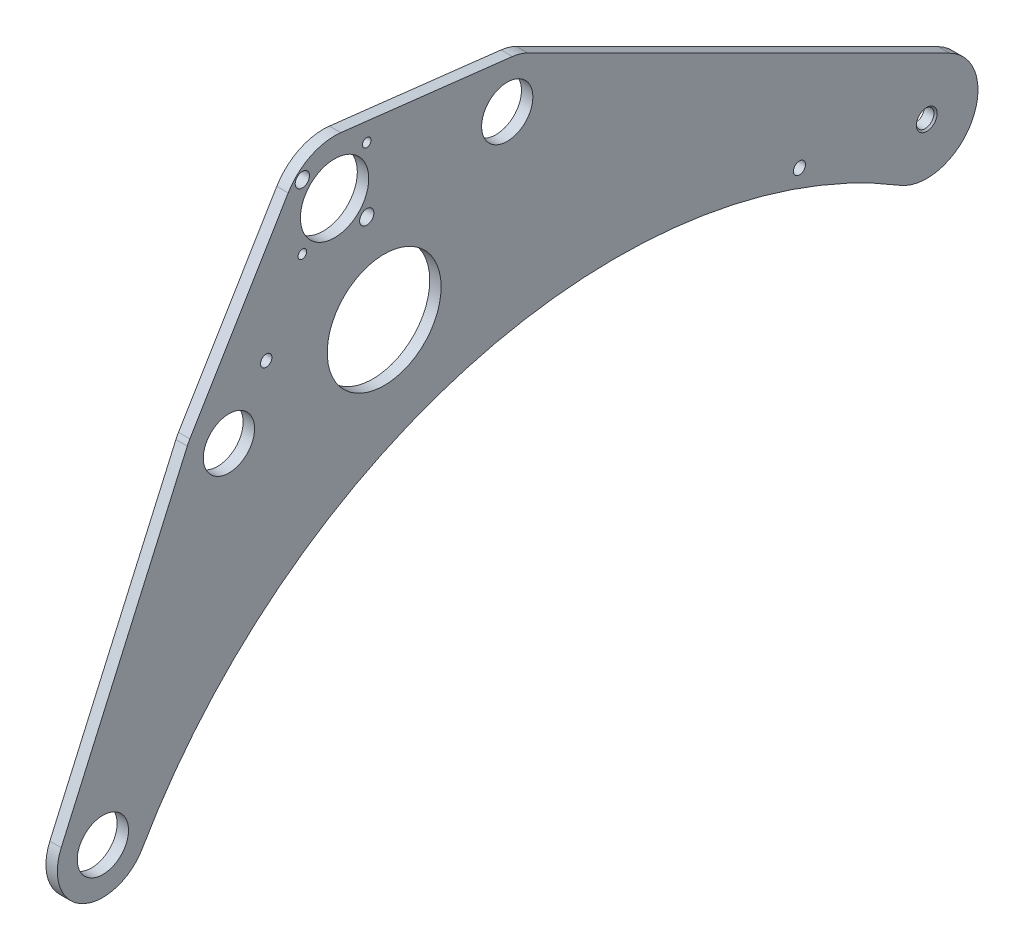
from build123d import *

# Parameters (mm, degrees)
SKETCH2_R                         = 3.3782
BOSS_EXTRUDE1_DEPTH               = 6.35
CUT_EXTRUDE1_REACH                = 511.657
SKETCH3_R                         = 14.2875
SKETCH3_R_2                       = 19.05
SKETCH3_R_3                       = 2.413
SKETCH3_R_4                       = 3.96875
SKETCH3_R_5                       = 3.175
F_3_8_CLEARANCE_HOLE2_D           = 9.8044
F_3_8_CLEARANCE_HOLE2_CSINK_D     = 11.58748
F_3_8_CLEARANCE_HOLE2_CSINK_ANGLE = 90
SKETCH11_R                        = 31.75
CUT_EXTRUDE2_DEPTH                = 510.656927172


with BuildPart() as part:
    # Sketch2 → Boss-Extrude1 (new body)
    with BuildSketch(Plane(origin=(0, 0, 0), x_dir=(0, 0, -1), z_dir=(1, 0, 0))):
        with BuildLine():
            Line((-482.60379809, -110.367631362), (-412.322756293, 48.382368638))
            ThreePointArc((-412.322756293, 48.382368638), (-411.642992745, 49.797905267), (-410.877057917, 51.168732123))
            Line((-410.877057917, 51.168732123), (-356.063745658, 142.519119396))
            ThreePointArc((-356.063745658, 142.519119396), (-343.524529027, 154.059810281), (-326.731846348, 156.96244844))
            Line((-326.731846348, 156.96244844), (-231.000424083, 145.881535528))
            ThreePointArc((-231.000424083, 145.881535528), (-226.66558004, 144.991718321), (-222.550960178, 143.363052937))
            Line((-222.550960178, 143.363052937), (12.791266142, 25.552184554))
            ThreePointArc((12.791266142, 25.552184554), (25.010542, -13.820398469), (-14.82663888, -24.427472332))
            ThreePointArc((-14.82663888, -24.427472332), (-57.930383226, -2.733370147), (-103.917723134, 11.886185744))
            ThreePointArc((-103.917723134, 11.886185744), (-294.655865568, -5.528049493), (-437.347284158, -133.291321323))
            ThreePointArc((-437.347284158, -133.291321323), (-470.855508227, -143.308975656), (-482.60379809, -110.367631362))
        make_face()
        with Locations((-71.00414761, 12.059445777)):
            Circle(SKETCH2_R, mode=Mode.SUBTRACT)
    extrude(amount=BOSS_EXTRUDE1_DEPTH)

    # Sketch3 → Cut-Extrude1 (cut, up to next)
    with BuildSketch(Plane(origin=(6.35, 0, 0), x_dir=(0, 0, -1), z_dir=(1, 0, 0)), mode=Mode.PRIVATE) as cut_extrude1_sk1:
        with Locations((-233.920974527, 120.65)):
            Circle(SKETCH3_R)
    cut_extrude1_tool1 = extrude(cut_extrude1_sk1.sketch, amount=-CUT_EXTRUDE1_REACH, mode=Mode.PRIVATE) & part.part
    # Sketch3 → Cut-Extrude1 (cut, up to next)
    with BuildSketch(Plane(origin=(6.35, 0, 0), x_dir=(0, 0, -1), z_dir=(1, 0, 0)), mode=Mode.PRIVATE) as cut_extrude1_sk2:
        with Locations((-389.097061574, 38.1)):
            Circle(SKETCH3_R)
    cut_extrude1_tool2 = extrude(cut_extrude1_sk2.sketch, amount=-CUT_EXTRUDE1_REACH, mode=Mode.PRIVATE) & part.part
    # Sketch3 → Cut-Extrude1 (cut, up to next)
    with BuildSketch(Plane(origin=(6.35, 0, 0), x_dir=(0, 0, -1), z_dir=(1, 0, 0)), mode=Mode.PRIVATE) as cut_extrude1_sk3:
        with Locations((-459.378103371, -120.65)):
            Circle(SKETCH3_R)
    cut_extrude1_tool3 = extrude(cut_extrude1_sk3.sketch, amount=-CUT_EXTRUDE1_REACH, mode=Mode.PRIVATE) & part.part
    # Sketch3 → Cut-Extrude1 (cut, up to next)
    with BuildSketch(Plane(origin=(6.35, 0, 0), x_dir=(0, 0, -1), z_dir=(1, 0, 0)), mode=Mode.PRIVATE) as cut_extrude1_sk4:
        with Locations((-330.2, 127)):
            Circle(SKETCH3_R_2)
    cut_extrude1_tool4 = extrude(cut_extrude1_sk4.sketch, amount=-CUT_EXTRUDE1_REACH, mode=Mode.PRIVATE) & part.part
    # Sketch3 → Cut-Extrude1 (cut, up to next)
    with BuildSketch(Plane(origin=(6.35, 0, 0), x_dir=(0, 0, -1), z_dir=(1, 0, 0)), mode=Mode.PRIVATE) as cut_extrude1_sk5:
        with Locations((-348.160512242, 109.039487758)):
            Circle(SKETCH3_R_3)
    cut_extrude1_tool5 = extrude(cut_extrude1_sk5.sketch, amount=-CUT_EXTRUDE1_REACH, mode=Mode.PRIVATE) & part.part
    # Sketch3 → Cut-Extrude1 (cut, up to next)
    with BuildSketch(Plane(origin=(6.35, 0, 0), x_dir=(0, 0, -1), z_dir=(1, 0, 0)), mode=Mode.PRIVATE) as cut_extrude1_sk6:
        with Locations((-312.239487758, 109.039487758)):
            Circle(SKETCH3_R_4)
    cut_extrude1_tool6 = extrude(cut_extrude1_sk6.sketch, amount=-CUT_EXTRUDE1_REACH, mode=Mode.PRIVATE) & part.part
    # Sketch3 → Cut-Extrude1 (cut, up to next)
    with BuildSketch(Plane(origin=(6.35, 0, 0), x_dir=(0, 0, -1), z_dir=(1, 0, 0)), mode=Mode.PRIVATE) as cut_extrude1_sk7:
        with Locations((-312.239487758, 144.960512242)):
            Circle(SKETCH3_R_3)
    cut_extrude1_tool7 = extrude(cut_extrude1_sk7.sketch, amount=-CUT_EXTRUDE1_REACH, mode=Mode.PRIVATE) & part.part
    # Sketch3 → Cut-Extrude1 (cut, up to next)
    with BuildSketch(Plane(origin=(6.35, 0, 0), x_dir=(0, 0, -1), z_dir=(1, 0, 0)), mode=Mode.PRIVATE) as cut_extrude1_sk8:
        with Locations((-348.160512242, 144.960512242)):
            Circle(SKETCH3_R_4)
    cut_extrude1_tool8 = extrude(cut_extrude1_sk8.sketch, amount=-CUT_EXTRUDE1_REACH, mode=Mode.PRIVATE) & part.part
    # Sketch3 → Cut-Extrude1 (cut, up to next)
    with BuildSketch(Plane(origin=(6.35, 0, 0), x_dir=(0, 0, -1), z_dir=(1, 0, 0)), mode=Mode.PRIVATE) as cut_extrude1_sk9:
        with Locations((-368.3, 67.687977544)):
            Circle(SKETCH3_R_5)
    cut_extrude1_tool9 = extrude(cut_extrude1_sk9.sketch, amount=-CUT_EXTRUDE1_REACH, mode=Mode.PRIVATE) & part.part
    add(cut_extrude1_tool1.solids().sort_by_distance((6.35, 120.65, 233.920975))[0], mode=Mode.SUBTRACT)
    add(cut_extrude1_tool2.solids().sort_by_distance((6.35, 38.1, 389.097062))[0], mode=Mode.SUBTRACT)
    add(cut_extrude1_tool3.solids().sort_by_distance((6.35, -120.65, 459.378103))[0], mode=Mode.SUBTRACT)
    add(cut_extrude1_tool4.solids().sort_by_distance((6.35, 127, 330.2))[0], mode=Mode.SUBTRACT)
    add(cut_extrude1_tool5.solids().sort_by_distance((6.35, 109.039488, 348.160512))[0], mode=Mode.SUBTRACT)
    add(cut_extrude1_tool6.solids().sort_by_distance((6.35, 109.039488, 312.239488))[0], mode=Mode.SUBTRACT)
    add(cut_extrude1_tool7.solids().sort_by_distance((6.35, 144.960512, 312.239488))[0], mode=Mode.SUBTRACT)
    add(cut_extrude1_tool8.solids().sort_by_distance((6.35, 144.960512, 348.160512))[0], mode=Mode.SUBTRACT)
    add(cut_extrude1_tool9.solids().sort_by_distance((6.35, 67.687978, 368.3))[0], mode=Mode.SUBTRACT)

    # 3/8 Clearance Hole2 (through all)
    with Locations(Plane(origin=(6.35, 0, 0), x_dir=(0, 0, -1), z_dir=(1, 0, 0))):
        with Locations((0, 0)):
            CounterSinkHole(F_3_8_CLEARANCE_HOLE2_D / 2, F_3_8_CLEARANCE_HOLE2_CSINK_D / 2, counter_sink_angle=F_3_8_CLEARANCE_HOLE2_CSINK_ANGLE)

    # Sketch11 → Cut-Extrude2 (cut, through all)
    with BuildSketch(Plane(origin=(6.35, 0, 0), x_dir=(0, 0, -1), z_dir=(1, 0, 0))):
        with Locations((-302.529373774, 54.491676918)):
            Circle(SKETCH11_R)
    extrude(amount=-CUT_EXTRUDE2_DEPTH, mode=Mode.SUBTRACT)


solid = part.part
